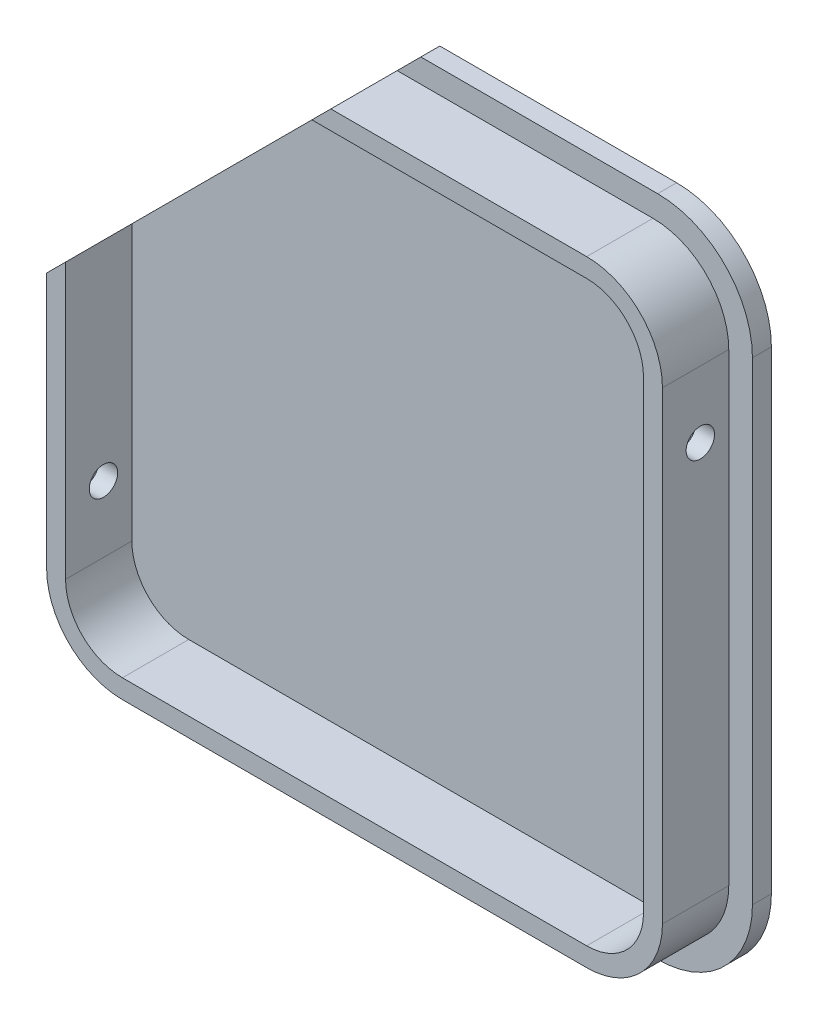
from build123d import *

# Parameters (mm, degrees)
EXTRUDE_1_DEPTH     = 2
EXTRUDE_2_DEPTH     = 7
SHELL_1_T           = -2
SKETCH_3_R          = 1.5
CUT_EXTRUDE_1_DEPTH = 7
SKETCH_4_R          = 1.5
CUT_EXTRUDE_2_DEPTH = 7
CUT_EXTRUDE_3_DEPTH = 10


with BuildPart() as part:
    # 草图1 → 凸台-拉伸1 (new body)
    with BuildSketch(Plane.XY):
        with BuildLine():
            Line((-23.108505897, 22.918009168), (26.891494103, 22.918009168))
            ThreePointArc((26.891494103, 22.918009168), (33.962561915, 19.989076979), (36.891494103, 12.918009168))
            Line((36.891494103, 12.918009168), (36.891494103, -37.081990832))
            ThreePointArc((36.891494103, -37.081990832), (33.962561915, -44.153058644), (26.891494103, -47.081990832))
            Line((26.891494103, -47.081990832), (-23.108505897, -47.081990832))
            ThreePointArc((-23.108505897, -47.081990832), (-30.179573709, -44.153058644), (-33.108505897, -37.081990832))
            Line((-33.108505897, -37.081990832), (-33.108505897, 12.918009168))
            ThreePointArc((-33.108505897, 12.918009168), (-30.179573709, 19.989076979), (-23.108505897, 22.918009168))
        make_face()
    extrude(amount=EXTRUDE_1_DEPTH)

    # 草图2 → 凸台-拉伸2 (add)
    with BuildSketch(Plane.XY.offset(2)):
        with BuildLine():
            Line((-22.608505897, 20.418009168), (26.391494103, 20.418009168))
            ThreePointArc((26.391494103, 20.418009168), (32.048348353, 18.074863417), (34.391494103, 12.418009168))
            Line((34.391494103, 12.418009168), (34.391494103, -36.581990832))
            ThreePointArc((34.391494103, -36.581990832), (32.048348353, -42.238845082), (26.391494103, -44.581990832))
            Line((26.391494103, -44.581990832), (-22.608505897, -44.581990832))
            ThreePointArc((-22.608505897, -44.581990832), (-28.265360146, -42.238845082), (-30.608505897, -36.581990832))
            Line((-30.608505897, -36.581990832), (-30.608505897, 12.418009168))
            ThreePointArc((-30.608505897, 12.418009168), (-28.265360146, 18.074863417), (-22.608505897, 20.418009168))
        make_face()
    extrude(amount=EXTRUDE_2_DEPTH)

    # 抽壳1
    shell_1_openings = [part.faces().sort_by_distance(p)[0] for p in [
        (1.891494103, -12.081990832, 9),
    ]]
    offset(amount=SHELL_1_T, openings=shell_1_openings, kind=Kind.INTERSECTION)

    # 草图3 → 切除-拉伸1 (cut)
    with BuildSketch(Plane.ZY.offset(30.608505897)):
        with Locations((5, -29.581990832)):
            Circle(SKETCH_3_R)
    extrude(amount=-CUT_EXTRUDE_1_DEPTH, mode=Mode.SUBTRACT)

    # 草图4 → 切除-拉伸2 (cut)
    with BuildSketch(Plane(origin=(34.391494103, 0, 0), x_dir=(0, 0, -1), z_dir=(1, 0, 0))):
        with Locations((-5, 5.418009168)):
            Circle(SKETCH_4_R)
    extrude(amount=-CUT_EXTRUDE_2_DEPTH, mode=Mode.SUBTRACT)

    # 草图5 → 切除-拉伸3 (cut, symmetric)
    with BuildSketch(Plane.XY.offset(2)):
        with BuildLine():
            Line((-33.108505897, 12.918009168), (-33.108505897, -12.081990832))
            Line((-33.108505897, -12.081990832), (1.891494103, 22.918009168))
            Line((1.891494103, 22.918009168), (-23.108505897, 22.918009168))
            ThreePointArc((-23.108505897, 22.918009168), (-30.179573709, 19.989076979), (-33.108505897, 12.918009168))
        make_face()
    extrude(amount=CUT_EXTRUDE_3_DEPTH, both=True, mode=Mode.SUBTRACT)


solid = part.part
